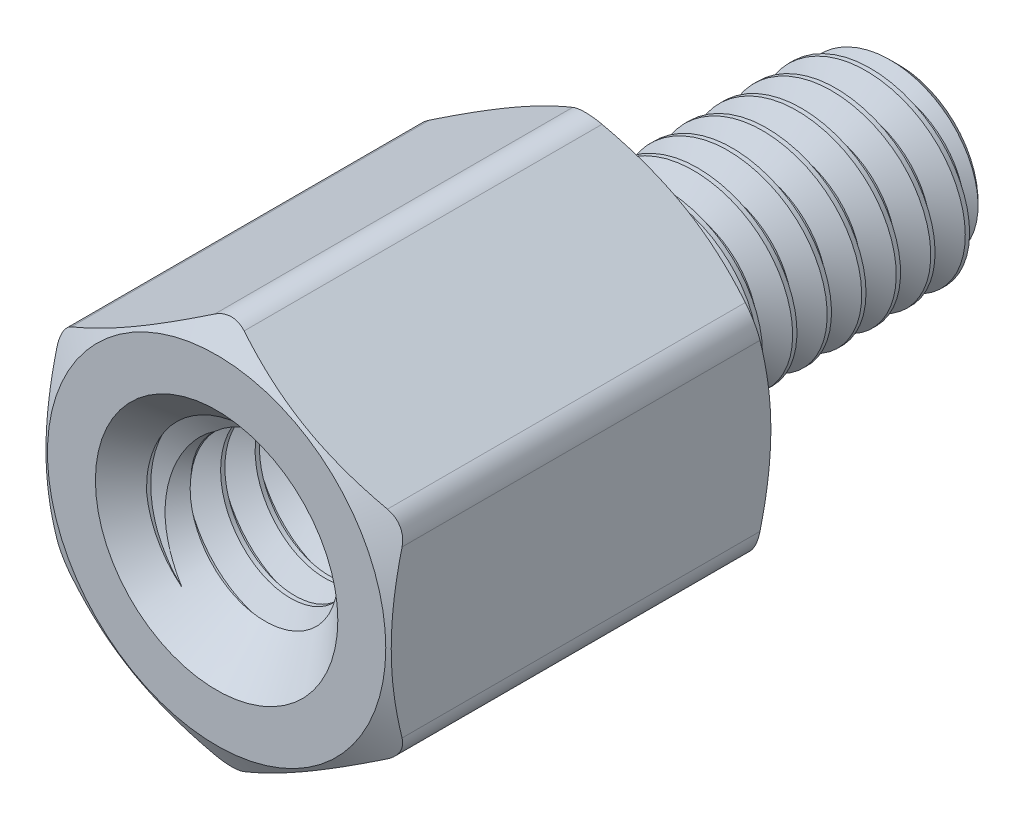
from build123d import *

# Parameters (mm, degrees)
SKETCH4_R           = 1.75
BOSS_EXTRUDE1_DEPTH = 5
SKETCH5_OUTSIDE_W   = 45.262
SKETCH5_OUTSIDE_H   = 45.958
SKETCH5_OUTSIDE_R   = 2.205
CUT_EXTRUDE1_DEPTH  = 10.540571262
CUT_EXTRUDE1_DRAFT  = -60
SKETCH6_OUTSIDE_W   = 33.232
SKETCH6_OUTSIDE_H   = 33.928
SKETCH6_OUTSIDE_R   = 2.205
CUT_EXTRUDE2_DEPTH  = 7.06733055
CUT_EXTRUDE2_DRAFT  = -60
FILLET1_R           = 0.3825
CUT_SWEEP1_PITCH    = 0.45
SKETCH9_R           = 1.475
BOSS_EXTRUDE2_DEPTH = 1.9
SKETCH10_W          = 1.9
SKETCH10_H          = 1.25
CUT_SWEEP2_PITCH    = 0.45


with BuildPart() as part:
    # Sketch3 → Revolve1 (revolve)
    with BuildSketch(Plane(origin=(0, 0, 0), x_dir=(0, 0, -1), z_dir=(1, 0, 0))):
        with BuildLine():
            Line((-3.1, 1.025), (-3.1, 0))
            Line((-3.1, 0), (3.9, 0))
            Line((3.9, 0), (3.9, 1.025))
            Line((3.9, 1.025), (3.675, 1.25))
            Line((3.675, 1.25), (0.63675, 1.25))
            Line((0.63675, 1.25), (0.468, 0.957716426))
            Line((0.468, 0.957716426), (0.225, 0.957716426))
            ThreePointArc((0.225, 0.957716426), (0.065900974, 1.0236174), (0, 1.182716426))
            Line((0, 1.182716426), (0, 2.25))
            Line((0, 2.25), (-5, 2.25))
            Line((-5, 2.25), (-5, 1.475))
            Line((-5, 1.475), (-4.775, 1.25))
            Line((-4.775, 1.25), (-3.325, 1.25))
            Line((-3.325, 1.25), (-3.1, 1.025))
        make_face()
    revolve(axis=Axis((0, 0, -3.9), (0, 0, 1)))

    # Sketch4 → Boss-Extrude1 (add)
    with BuildSketch(Plane.XY.offset(5)):
        Polygon((-2.25, 1.299038106), (-2.25, -1.299038106), (0, -2.598076211), (2.25, -1.299038106), (2.25, 1.299038106), (0, 2.598076211), align=None)
        Circle(SKETCH4_R, mode=Mode.SUBTRACT)
    extrude(amount=-BOSS_EXTRUDE1_DEPTH)


with BuildPart() as cut_extrude1_tool:
    # Sketch5 outside → Cut-Extrude1 (with draft: the straight prism first)
    with BuildSketch(Plane.XY.offset(5)):
        Rectangle(SKETCH5_OUTSIDE_W, SKETCH5_OUTSIDE_H)
        Circle(SKETCH5_OUTSIDE_R, mode=Mode.SUBTRACT)
    extrude(amount=-CUT_EXTRUDE1_DEPTH)
    # Cut-Extrude1: the draft: its side faces are tilted about the plane it starts from
    cut_extrude1_sides = [cut_extrude1_tool.faces().sort_by_distance(p)[0] for p in [
        (0, -22.979, -0.270285631),
        (22.631, 0, -0.270285631),
        (0, 22.979, -0.270285631),
        (-22.631, 0, -0.270285631),
        (-2.205, 0, -0.270285631),
    ]]
    draft(cut_extrude1_sides, Plane.XY.offset(5), CUT_EXTRUDE1_DRAFT)


with BuildPart() as part_1:
    add(part.part)

    # Cut-Extrude1: cut by cut_extrude1_tool
    add(cut_extrude1_tool.part, mode=Mode.SUBTRACT)


with BuildPart() as cut_extrude2_tool:
    # Sketch6 outside → Cut-Extrude2 (with draft: the straight prism first)
    with BuildSketch(Plane(origin=(0, 0, 0), x_dir=(-1, 0, 0), z_dir=(0, 0, -1))):
        Rectangle(SKETCH6_OUTSIDE_W, SKETCH6_OUTSIDE_H)
        Circle(SKETCH6_OUTSIDE_R, mode=Mode.SUBTRACT)
    extrude(amount=-CUT_EXTRUDE2_DEPTH)
    # Cut-Extrude2: the draft: its side faces are tilted about the plane it starts from
    cut_extrude2_sides = [cut_extrude2_tool.faces().sort_by_distance(p)[0] for p in [
        (0, -16.964, 3.533665275),
        (-16.616, 0, 3.533665275),
        (0, 16.964, 3.533665275),
        (16.616, 0, 3.533665275),
        (2.205, 0, 3.533665275),
    ]]
    draft(cut_extrude2_sides, Plane(origin=(0, 0, 0), x_dir=(-1, 0, 0), z_dir=(0, 0, -1)), CUT_EXTRUDE2_DRAFT)


with BuildPart() as part_2:
    add(part_1.part)

    # Cut-Extrude2: cut by cut_extrude2_tool
    add(cut_extrude2_tool.part, mode=Mode.SUBTRACT)

    # Fillet1
    fillet1_edges = [part_2.edges().sort_by_distance(p)[0] for p in [
        (0, 2.598076211, 2.5),
        (-2.25, -1.299038106, 2.5),
        (0, -2.598076211, 2.5),
        (2.25, -1.299038106, 2.5),
        (2.25, 1.299038106, 2.5),
        (-2.25, 1.299038106, 2.5),
    ]]
    fillet(fillet1_edges, radius=FILLET1_R)

    # Cut-Sweep1: the profile of Sketch7 profile screwed along a right-hand helix of 8.406667 turns, 6 arcs to a turn; built about Z, then put on its axis
    cut_sweep1_z = Axis((0, 0, 0), (0, 0, 1))
    cut_sweep1_corners = [(0.957416426, 0, -0.168923205), (0.957416426, 0, -0.224826795), (1.274356964, 0, -0.4078125), (1.274356964, 0, 0.0140625)]
    with BuildLine(mode=Mode.PRIVATE) as cut_sweep1_profile:
        Line(cut_sweep1_corners[0], cut_sweep1_corners[1])
        Line(cut_sweep1_corners[1], cut_sweep1_corners[2])
        Line(cut_sweep1_corners[2], cut_sweep1_corners[3])
        Line(cut_sweep1_corners[3], cut_sweep1_corners[0])
    cut_sweep1_cap = Face(cut_sweep1_profile.wire())
    cut_sweep1_turn_angles = [0, 30, 60, 90, 120, 150, 180, 210, 240, 270, 300, 330, 360]
    cut_sweep1_turn_weights = [1, 0.8660254037844387, 1, 0.8660254037844387, 1, 0.8660254037844387, 1, 0.8660254037844387, 1, 0.8660254037844387, 1, 0.8660254037844387, 1]
    cut_sweep1_turn_rails = [Edge.make_bspline([Vector(p[0], p[1], 0).rotate(cut_sweep1_z, cut_sweep1_turn_angles[k]) / cut_sweep1_turn_weights[k] + Vector(0, 0, p[2] + CUT_SWEEP1_PITCH * cut_sweep1_turn_angles[k] / 360) for k in range(13)], [0, 0, 0, 1, 1, 2, 2, 3, 3, 4, 4, 5, 5, 6, 6, 6], 2, cut_sweep1_turn_weights) for p in cut_sweep1_corners]
    cut_sweep1_turn_sides = [Face.make_surface_from_curves(cut_sweep1_turn_rails[p[0]], cut_sweep1_turn_rails[p[1]]) for p in [(0, 1), (1, 2), (2, 3), (3, 0)]]
    cut_sweep1_last_angles = [2880, 2910, 2940, 2970, 3000, 3013.2, 3026.4]
    cut_sweep1_last_weights = [1, 0.8660254037844387, 1, 0.8660254037844387, 1, 0.9735789028731555, 1]
    cut_sweep1_last_rails = [Edge.make_bspline([Vector(p[0], p[1], 0).rotate(cut_sweep1_z, cut_sweep1_last_angles[k]) / cut_sweep1_last_weights[k] + Vector(0, 0, p[2] + CUT_SWEEP1_PITCH * cut_sweep1_last_angles[k] / 360) for k in range(7)], [0, 0, 0, 1, 1, 2, 2, 3, 3, 3], 2, cut_sweep1_last_weights) for p in cut_sweep1_corners]
    cut_sweep1_last_sides = [Face.make_surface_from_curves(cut_sweep1_last_rails[p[0]], cut_sweep1_last_rails[p[1]]) for p in [(0, 1), (1, 2), (2, 3), (3, 0)]]
    cut_sweep1 = Plane(origin=(0, 0, -3.9), x_dir=(0, 1, 0), z_dir=(0, 0, 1)) * Solid(Shell([*[p.moved(Location((0, 0, CUT_SWEEP1_PITCH * i))) for i in range(8) for p in cut_sweep1_turn_sides], *cut_sweep1_last_sides, cut_sweep1_cap, cut_sweep1_cap.rotate(cut_sweep1_z, 3026.4).moved(Location((0, 0, CUT_SWEEP1_PITCH * 3026.4 / 360)))]))
    add(cut_sweep1, mode=Mode.SUBTRACT)

    # Sketch9 → Boss-Extrude2 (add)
    with BuildSketch(Plane.XY.offset(3.1)):
        Circle(SKETCH9_R)
    extrude(amount=BOSS_EXTRUDE2_DEPTH)


with BuildPart() as body_2:
    # Sketch10 → Revolve2 (revolve)
    with BuildSketch(Plane(origin=(0, 0, 0), x_dir=(0, 0, -1), z_dir=(1, 0, 0))):
        with Locations((-4.05, 0.625)):
            Rectangle(SKETCH10_W, SKETCH10_H)
    revolve(axis=Axis((0, 0, -3.9), (0, 0, 1)))

    # Cut-Sweep2: the profile of Sketch12 profile screwed along a right-hand helix of 5.222222 turns, 6 arcs to a turn; built about Z, then put on its axis
    cut_sweep2_z = Axis((0, 0, 0), (0, 0, 1))
    cut_sweep2_corners = [(0.957416426, 0, -0.224826795), (0.957416426, 0, -0.168923205), (1.274356964, 0, 0.0140625), (1.274356964, 0, -0.4078125)]
    with BuildLine(mode=Mode.PRIVATE) as cut_sweep2_profile:
        Line(cut_sweep2_corners[0], cut_sweep2_corners[1])
        Line(cut_sweep2_corners[1], cut_sweep2_corners[2])
        Line(cut_sweep2_corners[2], cut_sweep2_corners[3])
        Line(cut_sweep2_corners[3], cut_sweep2_corners[0])
    cut_sweep2_cap = Face(cut_sweep2_profile.wire())
    cut_sweep2_turn_angles = [0, 30, 60, 90, 120, 150, 180, 210, 240, 270, 300, 330, 360]
    cut_sweep2_turn_weights = [1, 0.8660254037844387, 1, 0.8660254037844387, 1, 0.8660254037844387, 1, 0.8660254037844387, 1, 0.8660254037844387, 1, 0.8660254037844387, 1]
    cut_sweep2_turn_rails = [Edge.make_bspline([Vector(p[0], p[1], 0).rotate(cut_sweep2_z, cut_sweep2_turn_angles[k]) / cut_sweep2_turn_weights[k] + Vector(0, 0, p[2] + CUT_SWEEP2_PITCH * cut_sweep2_turn_angles[k] / 360) for k in range(13)], [0, 0, 0, 1, 1, 2, 2, 3, 3, 4, 4, 5, 5, 6, 6, 6], 2, cut_sweep2_turn_weights) for p in cut_sweep2_corners]
    cut_sweep2_turn_sides = [Face.make_surface_from_curves(cut_sweep2_turn_rails[p[0]], cut_sweep2_turn_rails[p[1]]) for p in [(0, 1), (1, 2), (2, 3), (3, 0)]]
    cut_sweep2_last_angles = [1800, 1830, 1860, 1870, 1880]
    cut_sweep2_last_weights = [1, 0.8660254037844387, 1, 0.9848077530122011, 1]
    cut_sweep2_last_rails = [Edge.make_bspline([Vector(p[0], p[1], 0).rotate(cut_sweep2_z, cut_sweep2_last_angles[k]) / cut_sweep2_last_weights[k] + Vector(0, 0, p[2] + CUT_SWEEP2_PITCH * cut_sweep2_last_angles[k] / 360) for k in range(5)], [0, 0, 0, 1, 1, 2, 2, 2], 2, cut_sweep2_last_weights) for p in cut_sweep2_corners]
    cut_sweep2_last_sides = [Face.make_surface_from_curves(cut_sweep2_last_rails[p[0]], cut_sweep2_last_rails[p[1]]) for p in [(0, 1), (1, 2), (2, 3), (3, 0)]]
    cut_sweep2 = Plane(origin=(0, 0, 5), x_dir=(0, 1, 0), z_dir=(0, 0, -1)) * Solid(Shell([*[p.moved(Location((0, 0, CUT_SWEEP2_PITCH * i))) for i in range(5) for p in cut_sweep2_turn_sides], *cut_sweep2_last_sides, cut_sweep2_cap, cut_sweep2_cap.rotate(cut_sweep2_z, 1880).moved(Location((0, 0, CUT_SWEEP2_PITCH * 1880 / 360)))]))
    add(cut_sweep2, mode=Mode.SUBTRACT)


with BuildPart() as part_3:
    add(part_2.part)

    # Combine1: cut body 2
    add(body_2.part, mode=Mode.SUBTRACT)

    # Cut-Extrude3 cone 1 section (through the dimple's axis) → Cut-Extrude3 (revolve, cut)
    with BuildSketch(Plane(origin=(0, 0, 5), x_dir=(0, -1, 0), z_dir=(1, 0, 0))):
        Polygon((0, 0), (1.58, 0), (0, 1.58), align=None)
    revolve(axis=Axis((0, 0, 5), (0, 0, -1)), mode=Mode.SUBTRACT)


solid = part_3.part
